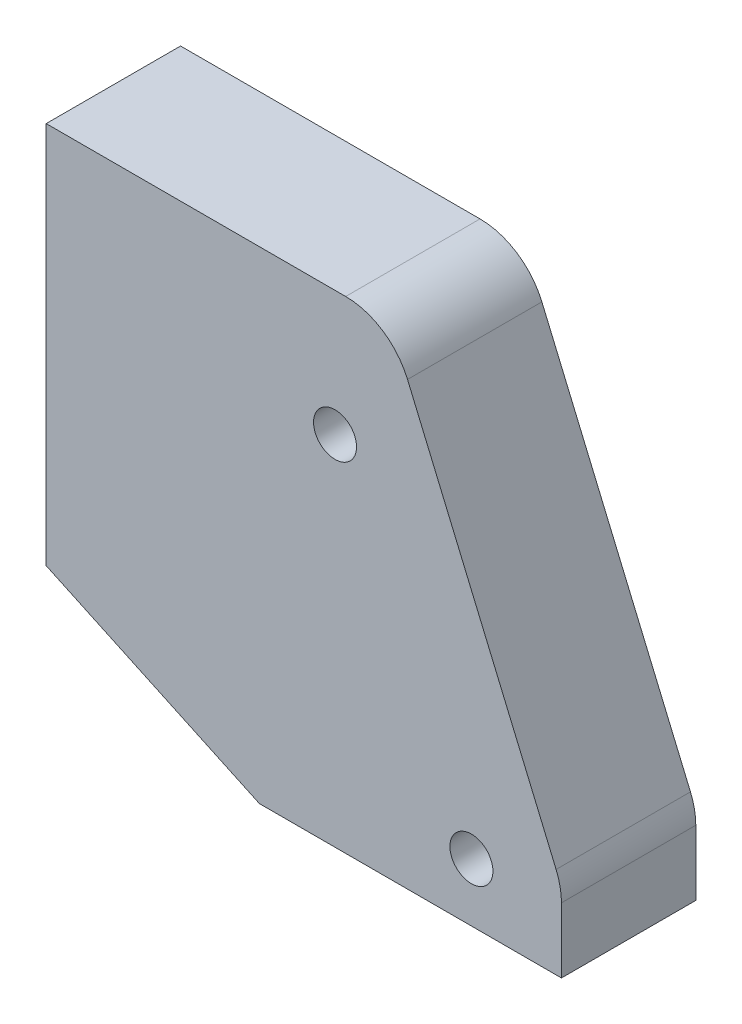
from build123d import *

# Parameters (mm, degrees)
SKETCH1_R           = 1.6
BOSS_EXTRUDE1_DEPTH = 10
CAVITY1_OUTLINE_R   = 1.25
CAVITY1_DEPTH       = 6.34
CAVITY1_START       = -22.606898648
CAVITY1_2_OUTLINE_R = 0.9
CAVITY1_2_DEPTH     = 0.47
CAVITY1_START_2     = -15.306898648
CAVITY1_3_OUTLINE_R = 0.9
CAVITY1_3_DEPTH     = 0.47
CAVITY1_START_3     = -6.506898648
CAVITY1_4_OUTLINE_R = 0.9
CAVITY1_4_DEPTH     = 0.47
CUT_EXTRUDE2_REACH  = 54.912
SKETCH2_R           = 1.15
CUT_EXTRUDE3_START  = -3.5
SKETCH3_R           = 1.15
CUT_EXTRUDE3_DEPTH  = 3.5
FILLET1_R           = 1
FILLET2_R           = 5
CUT_EXTRUDE4_START  = -6.34
CUT_EXTRUDE4_DEPTH  = 6.34
FILLET3_R           = 2
FILLET4_R           = 2
FILLET5_R           = 0.5


with BuildPart() as part:
    # Sketch1 → Boss-Extrude1 (new body)
    with BuildSketch(Plane.XY):
        Polygon((0, 0), (25.6, 0), (38.35, -30.037117664), (38.35, -35.9), (15.869351212, -35.9), (0, -28.5), align=None)
        with Locations((31.648794461, -31.570900751)):
            Circle(SKETCH1_R, mode=Mode.SUBTRACT)
        with Locations((21.498394042, -9.298229799)):
            Circle(SKETCH1_R, mode=Mode.SUBTRACT)
    extrude(amount=BOSS_EXTRUDE1_DEPTH)

    # Cavity1: read off the stored shape, not the designer's step
    # Cavity1 outline → Cavity1 (cut)
    with BuildSketch(Plane.XY):
        Polygon((10.198394042, -24.671898648), (10.198394042, -21.671898648), (10.808394042, -21.171898648), (10.808394042, -18.171898648), (10.198394042, -17.671898648), (10.198394042, -12.171898648), (10.808394042, -11.671898648), (10.808394042, -8.671898648), (10.198394042, -8.171898648), (10.198394042, -4.671898648), (0, -4.671898648), (0, -14.603899938), (0.718394042, -15.191898648), (0.718394042, -24.671898648), align=None)
        with Locations((7.908394042, -19.671898648)):
            Circle(CAVITY1_OUTLINE_R, mode=Mode.SUBTRACT)
        with Locations((7.908394042, -10.171898648)):
            Circle(CAVITY1_OUTLINE_R, mode=Mode.SUBTRACT)
    extrude(amount=CAVITY1_DEPTH, mode=Mode.SUBTRACT)

    # Cavity1 2 outline → Cavity1 2 (cut)
    with BuildSketch(Plane(origin=(0, 0, 0), x_dir=(1, 0, 0), z_dir=(0, 1, 0)).offset(CAVITY1_START)):
        Polygon((13.478394042, -4.73), (14.198394042, -4.01), (14.198394042, -2.33), (13.478394042, -1.61), (10.198394042, -1.61), (10.198394042, -4.73), align=None)
        with Locations((12.398394042, -3.17)):
            Circle(CAVITY1_2_OUTLINE_R, mode=Mode.SUBTRACT)
    extrude(amount=CAVITY1_2_DEPTH, mode=Mode.SUBTRACT)

    # Cavity1 3 outline → Cavity1 3 (cut)
    with BuildSketch(Plane(origin=(0, 0, 0), x_dir=(1, 0, 0), z_dir=(0, 1, 0)).offset(CAVITY1_START_2)):
        Polygon((13.478394042, -4.73), (14.198394042, -4.01), (14.198394042, -2.33), (13.478394042, -1.61), (10.198394042, -1.61), (10.198394042, -4.73), align=None)
        with Locations((12.398394042, -3.17)):
            Circle(CAVITY1_3_OUTLINE_R, mode=Mode.SUBTRACT)
    extrude(amount=CAVITY1_3_DEPTH, mode=Mode.SUBTRACT)

    # Cavity1 4 outline → Cavity1 4 (cut)
    with BuildSketch(Plane(origin=(0, 0, 0), x_dir=(1, 0, 0), z_dir=(0, 1, 0)).offset(CAVITY1_START_3)):
        Polygon((13.478394042, -4.73), (14.198394042, -4.01), (14.198394042, -2.33), (13.478394042, -1.61), (10.198394042, -1.61), (10.198394042, -4.73), align=None)
        with Locations((12.398394042, -3.17)):
            Circle(CAVITY1_4_OUTLINE_R, mode=Mode.SUBTRACT)
    extrude(amount=CAVITY1_4_DEPTH, mode=Mode.SUBTRACT)

    # Cut-Extrude2: up to this face of the body (flat: up to its plane)
    cut_extrude2_end = Plane(part.part.faces().sort_by_distance((19.850612991, -19.341556746, 0))[0])
    # Sketch2 → Cut-Extrude2 (cut, up to the picked face)
    with BuildSketch(Plane(origin=(0, 0, 6.34), x_dir=(-1, 0, 0), z_dir=(0, 0, -1)), mode=Mode.PRIVATE) as cut_extrude2_sk1:
        Polygon((-10.908394042, -21.219231953), (-10.298394042, -21.719231953), (-10.298394042, -24.771898648), (-0.618394042, -24.771898648), (-0.618394042, -15.239275241), (0.1, -14.651276531), (0.1, -4.571898648), (-10.298394042, -4.571898648), (-10.298394042, -8.124565343), (-10.908394042, -8.624565343), (-10.908394042, -11.719231953), (-10.298394042, -12.219231953), (-10.298394042, -17.624565343), (-10.908394042, -18.124565343), align=None)
        with Locations((-7.908394042, -10.171898648)):
            Circle(SKETCH2_R, mode=Mode.SUBTRACT)
        with Locations((-7.908394042, -19.671898648)):
            Circle(SKETCH2_R, mode=Mode.SUBTRACT)
    cut_extrude2_tool1 = split(extrude(cut_extrude2_sk1.sketch, amount=CUT_EXTRUDE2_REACH, mode=Mode.PRIVATE), bisect_by=cut_extrude2_end, keep=Keep.BOTH, mode=Mode.PRIVATE)
    add(cut_extrude2_tool1.solids().sort_by(Axis((5.274649, -14.483088, 6.34), (0, 0, -1)))[0], mode=Mode.SUBTRACT)

    # Sketch3 → Cut-Extrude3 (cut)
    with BuildSketch(Plane(origin=(0, 0, 0), x_dir=(-1, 0, 0), z_dir=(0, 0, -1)).offset(CUT_EXTRUDE3_START)):
        with Locations((-7.908394042, -10.171898648)):
            Circle(SKETCH3_R)
        with Locations((-7.908394042, -19.671898648)):
            Circle(SKETCH3_R)
    extrude(amount=CUT_EXTRUDE3_DEPTH, mode=Mode.SUBTRACT)

    # Fillet1
    fillet1_edges = [part.edges().sort_by_distance(p)[0] for p in [
        (9.058394042, -10.171898648, 3.5),
        (9.058394042, -19.671898648, 3.5),
    ]]
    fillet(fillet1_edges, radius=FILLET1_R)

    # Fillet2
    fillet2_edges = [part.edges().sort_by_distance(p)[0] for p in [
        (25.6, 0, 5),
        (38.35, -30.037117664, 5),
    ]]
    fillet(fillet2_edges, radius=FILLET2_R)

    # Sketch4 → Cut-Extrude4 (cut)
    with BuildSketch(Plane(origin=(0, 0, 0), x_dir=(-1, 0, 0), z_dir=(0, 0, -1)).offset(CUT_EXTRUDE4_START)):
        Polygon((-10.298394042, -5.850997484), (-15.298394042, -5.850997484), (-23.35, -35.9), (-17.655981008, -35.9), (-14.377222224, -23.663505632), (-10.298394042, -23.663505632), (-10.298394042, -21.719231953), (-13.908394042, -21.719231953), (-13.908394042, -16.124565343), (-10.298394042, -16.124565343), (-10.298394042, -14.124565343), (-13.908394042, -14.124565343), (-13.908394042, -7.374565343), (-10.298394042, -7.374565343), align=None)
    extrude(amount=CUT_EXTRUDE4_DEPTH, mode=Mode.SUBTRACT)

    # Fillet3
    fillet3_edges = [part.edges().sort_by_distance(p)[0] for p in [
        (14.377222224, -23.663505632, 3.17),
        (13.908394042, -21.719231953, 3.17),
        (13.908394042, -16.124565343, 3.17),
        (13.908394042, -14.124565343, 3.17),
        (13.908394042, -7.374565343, 3.17),
    ]]
    fillet(fillet3_edges, radius=FILLET3_R)

    # Fillet4
    fillet4_edges = [part.edges().sort_by_distance(p)[0] for p in [
        (15.298394042, -5.850997484, 3.17),
    ]]
    fillet(fillet4_edges, radius=FILLET4_R)

    # Fillet5
    fillet5_edges = [part.edges().sort_by_distance(p)[0] for p in [
        (10.298394042, -5.850997484, 3.17),
        (10.298394042, -23.663505632, 3.17),
    ]]
    fillet(fillet5_edges, radius=FILLET5_R)


solid = part.part
